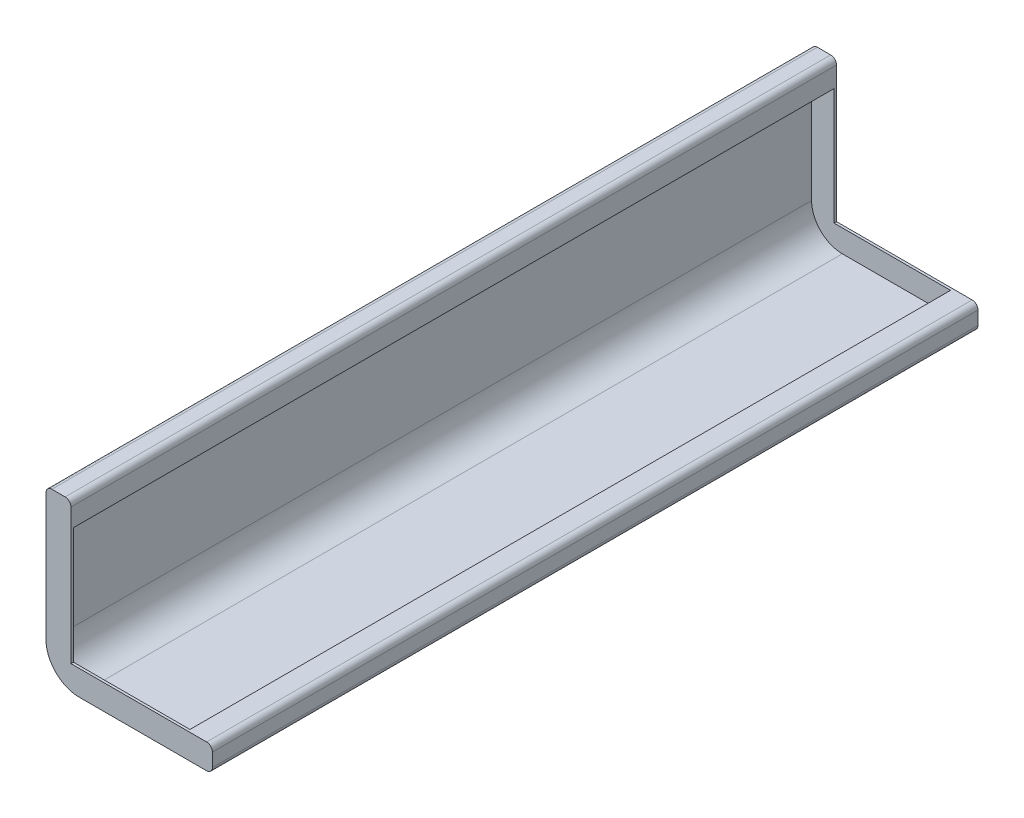
from build123d import *

# Parameters (mm, degrees)
SM_BASE_FLANGE_1_DEPTH             = 460
SM_EDGE_FLANGE_1_STRIP_W           = 10
SM_EDGE_FLANGE_1_STRIP_H           = 1.5
SM_EDGE_FLANGE_1_STRIP_CUT_DEPTH   = 460
SM_EDGE_FLANGE_1_STRIP_2_W         = 10
SM_EDGE_FLANGE_1_STRIP_2_H         = 1.5
SM_EDGE_FLANGE_1_STRIP_CUT_2_DEPTH = 460
SM_EDGE_FLANGE_1_DEPTH             = 460
SM_EDGE_FLANGE_1_BEND_DEPTH        = 460
SM_EDGE_FLANGE_2_STRIP_W           = 10
SM_EDGE_FLANGE_2_STRIP_H           = 1.5
SM_EDGE_FLANGE_2_STRIP_CUT_DEPTH   = 460
SM_EDGE_FLANGE_2_STRIP_2_W         = 10
SM_EDGE_FLANGE_2_STRIP_2_H         = 1.5
SM_EDGE_FLANGE_2_STRIP_CUT_2_DEPTH = 460
SM_EDGE_FLANGE_2_DEPTH             = 460
SM_EDGE_FLANGE_2_BEND_DEPTH        = 460
EXTRUDE_START                      = -1.5
EXTRUDE_1_DEPTH                    = 1.5
EXTRUDE_2_DEPTH                    = 1.5


# Sheet-metal steps are written as plain solids
with BuildPart() as part:
    # 草图1 → 基体-法兰1 (new body)
    with BuildSketch(Plane.XY):
        with BuildLine():
            Line((-60, 100), (-60, 20))
            ThreePointArc((-60, 20), (-54.142135624, 5.857864376), (-40, 0))
            Line((-40, 0), (40, 0))
            Line((40, 0), (40, 1.5))
            Line((40, 1.5), (-40, 1.5))
            ThreePointArc((-40, 1.5), (-53.081475452, 6.918524548), (-58.5, 20))
            Line((-58.5, 20), (-58.5, 100))
            Line((-58.5, 100), (-60, 100))
        make_face()
    extrude(amount=SM_BASE_FLANGE_1_DEPTH)

    # 边线-法兰1 strip (across the edge) → 边线-法兰1 strip cut (cut)
    with BuildSketch(Plane(origin=(40, 1.5, 460), x_dir=(-1, 0, 0), z_dir=(0, 0, -1))):
        with Locations((-1.5, -0.75)):
            Rectangle(SM_EDGE_FLANGE_1_STRIP_W, SM_EDGE_FLANGE_1_STRIP_H)
    extrude(amount=SM_EDGE_FLANGE_1_STRIP_CUT_DEPTH, mode=Mode.SUBTRACT)

    # 边线-法兰1 strip 2 (across the edge) → 边线-法兰1 strip cut 2 (cut)
    with BuildSketch(Plane(origin=(-58.5, 100, 0), x_dir=(0, -1, 0), z_dir=(0, 0, 1))):
        with Locations((-1.5, -0.75)):
            Rectangle(SM_EDGE_FLANGE_1_STRIP_2_W, SM_EDGE_FLANGE_1_STRIP_2_H)
    extrude(amount=SM_EDGE_FLANGE_1_STRIP_CUT_2_DEPTH, mode=Mode.SUBTRACT)

    # 边线-法兰1 section (across the edge) → 边线-法兰1 (add)
    with BuildSketch(Plane(origin=(40, 1.5, 460), x_dir=(-1, 0, 0), z_dir=(0, 0, -1))):
        with BuildLine():
            Line((0, 2), (0, 13.5))
            Line((0, 13.5), (1.5, 13.5))
            Line((1.5, 13.5), (1.5, 2))
            ThreePointArc((1.5, 2), (2.085786438, 0.585786438), (3.5, 0))
            Line((3.5, 0), (3.5, -1.5))
            ThreePointArc((3.5, -1.5), (1.025126266, -0.474873734), (0, 2))
        make_face()
    extrude(amount=SM_EDGE_FLANGE_1_DEPTH)

    # 边线-法兰1 section 2 (across the edge) → 边线-法兰1 bend (add)
    with BuildSketch(Plane(origin=(-58.5, 100, 0), x_dir=(0, -1, 0), z_dir=(0, 0, 1))):
        with BuildLine():
            Line((0, 2), (0, 13.5))
            Line((0, 13.5), (1.5, 13.5))
            Line((1.5, 13.5), (1.5, 2))
            ThreePointArc((1.5, 2), (2.085786438, 0.585786438), (3.5, 0))
            Line((3.5, 0), (3.5, -1.5))
            ThreePointArc((3.5, -1.5), (1.025126266, -0.474873734), (0, 2))
        make_face()
    extrude(amount=SM_EDGE_FLANGE_1_BEND_DEPTH)

    # 边线-法兰2 strip (across the edge) → 边线-法兰2 strip cut (cut)
    with BuildSketch(Plane(origin=(38.5, 15, 460), x_dir=(0, -1, 0), z_dir=(0, 0, -1))):
        with Locations((-1.5, -0.75)):
            Rectangle(SM_EDGE_FLANGE_2_STRIP_W, SM_EDGE_FLANGE_2_STRIP_H)
    extrude(amount=SM_EDGE_FLANGE_2_STRIP_CUT_DEPTH, mode=Mode.SUBTRACT)

    # 边线-法兰2 strip 2 (across the edge) → 边线-法兰2 strip cut 2 (cut)
    with BuildSketch(Plane(origin=(-45, 98.5, 0), x_dir=(-1, 0, 0), z_dir=(0, 0, 1))):
        with Locations((-1.5, -0.75)):
            Rectangle(SM_EDGE_FLANGE_2_STRIP_2_W, SM_EDGE_FLANGE_2_STRIP_2_H)
    extrude(amount=SM_EDGE_FLANGE_2_STRIP_CUT_2_DEPTH, mode=Mode.SUBTRACT)

    # 边线-法兰2 section (across the edge) → 边线-法兰2 (add)
    with BuildSketch(Plane(origin=(38.5, 15, 460), x_dir=(0, -1, 0), z_dir=(0, 0, -1))):
        with BuildLine():
            Line((0, 2), (0, 13.5))
            Line((0, 13.5), (1.5, 13.5))
            Line((1.5, 13.5), (1.5, 2))
            ThreePointArc((1.5, 2), (2.085786438, 0.585786438), (3.5, 0))
            Line((3.5, 0), (3.5, -1.5))
            ThreePointArc((3.5, -1.5), (1.025126266, -0.474873734), (0, 2))
        make_face()
    extrude(amount=SM_EDGE_FLANGE_2_DEPTH)

    # 边线-法兰2 section 2 (across the edge) → 边线-法兰2 bend (add)
    with BuildSketch(Plane(origin=(-45, 98.5, 0), x_dir=(-1, 0, 0), z_dir=(0, 0, 1))):
        with BuildLine():
            Line((0, 2), (0, 13.5))
            Line((0, 13.5), (1.5, 13.5))
            Line((1.5, 13.5), (1.5, 2))
            ThreePointArc((1.5, 2), (2.085786438, 0.585786438), (3.5, 0))
            Line((3.5, 0), (3.5, -1.5))
            ThreePointArc((3.5, -1.5), (1.025126266, -0.474873734), (0, 2))
        make_face()
    extrude(amount=SM_EDGE_FLANGE_2_BEND_DEPTH)

    # 草图22 → 凸台-拉伸1 (add)
    with BuildSketch(Plane.XY.offset(460).offset(EXTRUDE_START)):
        with BuildLine():
            Line((-45, 96.5), (-45, 85))
            Line((-45, 85), (-45, 15))
            Line((-45, 15), (25, 15))
            Line((25, 15), (36.5, 15))
            ThreePointArc((36.5, 15), (38.974873734, 13.974873734), (40, 11.5))
            Line((40, 11.5), (40, 3.5))
            ThreePointArc((40, 3.5), (38.974873734, 1.025126266), (36.5, 0))
            Line((36.5, 0), (-40, 0))
            ThreePointArc((-40, 0), (-54.142135624, 5.857864376), (-60, 20))
            Line((-60, 20), (-60, 96.5))
            ThreePointArc((-60, 96.5), (-58.974873734, 98.974873734), (-56.5, 100))
            Line((-56.5, 100), (-48.5, 100))
            ThreePointArc((-48.5, 100), (-46.025126266, 98.974873734), (-45, 96.5))
        make_face()
    extrude(amount=EXTRUDE_1_DEPTH)

    # 草图23 → 凸台-拉伸2 (add)
    with BuildSketch(Plane(origin=(0, 0, 0), x_dir=(-1, 0, 0), z_dir=(0, 0, -1))):
        with BuildLine():
            Line((-25, 15), (45, 15))
            Line((45, 15), (45, 85))
            Line((45, 85), (45, 96.5))
            ThreePointArc((45, 96.5), (46.025126266, 98.974873734), (48.5, 100))
            Line((48.5, 100), (56.5, 100))
            ThreePointArc((56.5, 100), (58.974873734, 98.974873734), (60, 96.5))
            Line((60, 96.5), (60, 20))
            ThreePointArc((60, 20), (54.142135624, 5.857864376), (40, 0))
            Line((40, 0), (-36.5, 0))
            ThreePointArc((-36.5, 0), (-38.974873734, 1.025126266), (-40, 3.5))
            Line((-40, 3.5), (-40, 11.5))
            ThreePointArc((-40, 11.5), (-38.974873734, 13.974873734), (-36.5, 15))
            Line((-36.5, 15), (-25, 15))
        make_face()
    extrude(amount=-EXTRUDE_2_DEPTH)


solid = part.part
